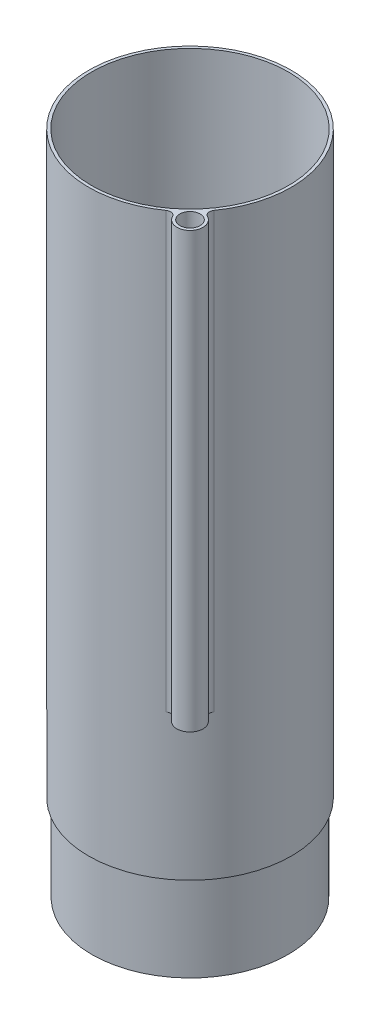
from build123d import *

# Parameters (mm, degrees)
SKETCH1_R           = 35
SKETCH1_R_2         = 34
BOSS_EXTRUDE1_DEPTH = 200
SKETCH2_R           = 34
SKETCH2_R_2         = 32.9
BOSS_EXTRUDE2_DEPTH = 2
BOSS_EXTRUDE3_START = 30
SKETCH3_R           = 33.9
SKETCH3_R_2         = 32.9
BOSS_EXTRUDE3_DEPTH = 30
SKETCH4_R           = 33.9
BOSS_EXTRUDE4_DEPTH = 2
SKETCH5_R           = 5
CUT_EXTRUDE1_DEPTH  = 2
SKETCH7_R           = 3
SKETCH7_R_2         = 2
BOSS_EXTRUDE8_DEPTH = 160
FILLET2_R           = 2
SKETCH8_R           = 2
CUT_EXTRUDE2_DEPTH  = 2
SKETCH9_R           = 4.5
SKETCH9_R_2         = 3.5
BOSS_EXTRUDE9_DEPTH = 150
FILLET3_R           = 2


with BuildPart() as part:
    # Sketch1 → Boss-Extrude1 (new body)
    with BuildSketch(Plane(origin=(0, 0, 0), x_dir=(1, 0, 0), z_dir=(0, 1, 0))):
        with Locations(Location((0, 0, 0), (0, 0, 270))):
            Circle(SKETCH1_R)
        with Locations(Location((0, 0, 0), (0, 0, 270))):
            Circle(SKETCH1_R_2, mode=Mode.SUBTRACT)
    extrude(amount=BOSS_EXTRUDE1_DEPTH)

    # Sketch2 → Boss-Extrude2 (add)
    with BuildSketch(Plane.XZ):
        with Locations(Location((0, 0, 0), (0, 0, 270))):
            Circle(SKETCH2_R)
        with Locations(Location((0, 0, 0), (0, 0, 270))):
            Circle(SKETCH2_R_2, mode=Mode.SUBTRACT)
    extrude(amount=-BOSS_EXTRUDE2_DEPTH)

    # Sketch3 → Boss-Extrude3 (add)
    with BuildSketch(Plane.XZ.offset(BOSS_EXTRUDE3_START)):
        with Locations(Location((0, 0, 0), (0, 0, 90))):
            Circle(SKETCH3_R)
        with Locations(Location((0, 0, 0), (0, 0, 270))):
            Circle(SKETCH3_R_2, mode=Mode.SUBTRACT)
    extrude(amount=-BOSS_EXTRUDE3_DEPTH)

    # Sketch4 → Boss-Extrude4 (add)
    with BuildSketch(Plane.XZ.offset(30)):
        with Locations(Location((0, 0, 0), (0, 0, 90))):
            Circle(SKETCH4_R)
    extrude(amount=-BOSS_EXTRUDE4_DEPTH)

    # Sketch5 → Cut-Extrude1 (cut)
    with BuildSketch(Plane.XZ.offset(30)):
        with Locations(Location((0, 0, 0), (0, 0, 270))):
            Circle(SKETCH5_R)
    extrude(amount=-CUT_EXTRUDE1_DEPTH, mode=Mode.SUBTRACT)

    # Sketch7 → Boss-Extrude8 (add)
    with BuildSketch(Plane(origin=(0, 2, 0), x_dir=(1, 0, 0), z_dir=(0, 1, 0))):
        with Locations((32, 0)):
            Circle(SKETCH7_R)
        with Locations(Location((32, 0, 0), (0, 0, 64.84439143))):
            Circle(SKETCH7_R_2, mode=Mode.SUBTRACT)
    extrude(amount=BOSS_EXTRUDE8_DEPTH)

    # Fillet2
    # the kernel refuses this fillet: 2 mm, written as the material it adds along each edge
    with BuildSketch(Plane(origin=(33.921875, 162, 2.303561695), x_dir=(-0.11187189352087389, 0, 0.9937226370773962), z_dir=(0, -1, 0))) as fillet2_piece_1:
        with BuildLine():
            CenterArc((2.923029325, 1.998037582), FILLET2_R, 178.057565486, 94.480798786)
            ThreePointArc((0.924178552, 2.06582835), (0.66436101, 0.942424954), (0, 0))
            ThreePointArc((0, 0), (1.505802985, -0.033361112), (3.011605971, 0))
        make_face()
    extrude(amount=160)
    with BuildSketch(Plane(origin=(33.921875, 162, -2.303561695), x_dir=(-0.11187189352087391, 0, -0.993722637077396), z_dir=(0, -1, 0))) as fillet2_piece_2:
        with BuildLine():
            CenterArc((2.923029325, -1.998037582), FILLET2_R, 87.461635728, 94.480798786)
            ThreePointArc((0.924178552, -2.06582835), (0.66436101, -0.942424954), (0, 0))
            ThreePointArc((0, 0), (1.505802985, 0.033361112), (3.011605971, 0))
        make_face()
    extrude(amount=160)

    # Sketch8 → Cut-Extrude2 (cut)
    with BuildSketch(Plane(origin=(0, -28, 0), x_dir=(1, 0, 0), z_dir=(0, 1, 0))):
        with Locations(Location((31.18904707, 0, 0), (0, 0, 270))):
            Circle(SKETCH8_R)
    extrude(amount=-CUT_EXTRUDE2_DEPTH, mode=Mode.SUBTRACT)

    # Sketch9 → Boss-Extrude9 (add)
    with BuildSketch(Plane(origin=(0, 200, 0), x_dir=(1, 0, 0), z_dir=(0, 1, 0))):
        with Locations((27.223611076, -27.223611076)):
            Circle(SKETCH9_R)
        with Locations(Location((27.223611076, -27.223611076, 0), (0, 0, 270))):
            Circle(SKETCH9_R_2, mode=Mode.SUBTRACT)
    extrude(amount=-BOSS_EXTRUDE9_DEPTH)

    # Fillet3
    fillet3_edges = [part.edges().sort_by_distance(p)[0] for p in [
        (26.580781197, 125, 22.769762207),
        (22.769762207, 125, 26.580781197),
    ]]
    fillet(fillet3_edges, radius=FILLET3_R)


solid = part.part
